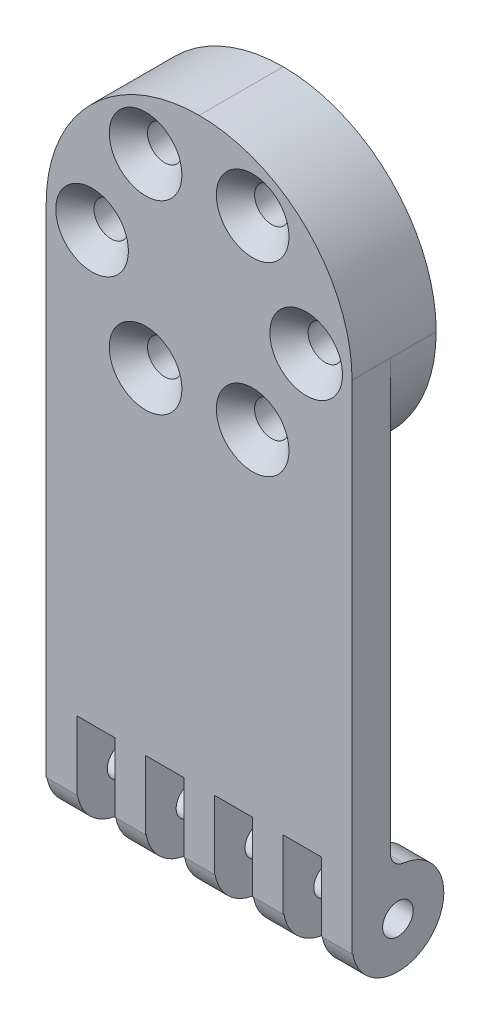
from build123d import *

# Parameters (mm, degrees)
SKETCH7_W           = 40
SKETCH7_H           = 40
BOSS_EXTRUDE1_DEPTH = 11
SKETCH8_W           = 40
SKETCH8_H           = 5
BOSS_EXTRUDE2_DEPTH = 36
SKETCH10_R          = 2.25
CUT_EXTRUDE1_DEPTH  = 25
FILLET1_R           = 20
SKETCH11_W          = 4
SKETCH11_H          = 5
BOSS_EXTRUDE3_DEPTH = 9
SKETCH14_R          = 6
BOSS_EXTRUDE4_DEPTH = 4
LPATTERN1_COUNT     = 5
LPATTERN1_PITCH     = 9
SKETCH15_R          = 2
CUT_EXTRUDE2_DEPTH  = 82.369527466
CHAMFER1_SIZE       = 2.5
FILLET2_R           = 2


with BuildPart() as part:
    # Sketch7 → Boss-Extrude1 (new body)
    with BuildSketch(Plane.XY):
        Rectangle(SKETCH7_W, SKETCH7_H)
    extrude(amount=BOSS_EXTRUDE1_DEPTH)

    # Sketch8 → Boss-Extrude2 (add)
    with BuildSketch(Plane.XZ.offset(20)):
        with Locations((0, 8.5)):
            Rectangle(SKETCH8_W, SKETCH8_H)
    extrude(amount=BOSS_EXTRUDE2_DEPTH)

    # Sketch10 → Cut-Extrude1 (cut)
    with BuildSketch(Plane.XY.offset(11)):
        with Locations((-7.00009521, 12.124420806)):
            Circle(SKETCH10_R)
        with Locations((6.99990479, 12.124420806)):
            Circle(SKETCH10_R)
        with Locations((13.99990479, 6.5153e-05)):
            Circle(SKETCH10_R)
        with Locations((6.99990479, -12.1242905)):
            Circle(SKETCH10_R)
        with Locations((-7.00009521, -12.1242905)):
            Circle(SKETCH10_R)
        with Locations((-14.00009521, 6.5153e-05)):
            Circle(SKETCH10_R)
    extrude(amount=-CUT_EXTRUDE1_DEPTH, mode=Mode.SUBTRACT)

    # Fillet1
    fillet1_edges = [part.edges().sort_by_distance(p)[0] for p in [
        (20, -20, 3),
        (20, 20, 5.5),
        (-20, 20, 5.5),
        (-20, -20, 3),
    ]]
    fillet(fillet1_edges, radius=FILLET1_R - 0.0001)  # a hair under: the kernel refuses the full size

    # Sketch11 → Boss-Extrude3 (add)
    with BuildSketch(Plane.XZ.offset(56)):
        with Locations((-18, 8.5)):
            Rectangle(SKETCH11_W, SKETCH11_H)
    boss_extrude3 = extrude(amount=BOSS_EXTRUDE3_DEPTH)

    # Sketch14 → Boss-Extrude4 (add)
    with BuildSketch(Plane(origin=(-16, 0, 0), x_dir=(0, 0, -1), z_dir=(1, 0, 0))):
        with Locations((-5, -64)):
            Circle(SKETCH14_R)
    boss_extrude4 = extrude(amount=-BOSS_EXTRUDE4_DEPTH)

    # LPattern1: Boss-Extrude3, Boss-Extrude4 ×5
    with Locations(*[(i * LPATTERN1_PITCH, 0, 0) for i in range(1, LPATTERN1_COUNT)]):
        add(boss_extrude3)
        add(boss_extrude4)

    # Sketch15 → Cut-Extrude2 (cut, through all)
    with BuildSketch(Plane.ZY.offset(20)):
        with Locations(Location((5, -64, 0), (0, 0, 270))):
            Circle(SKETCH15_R)
    extrude(amount=-CUT_EXTRUDE2_DEPTH, mode=Mode.SUBTRACT)

    # Chamfer1
    chamfer1_edges = [part.edges().sort_by_distance(p)[0] for p in [
        (-16.25009521, 6.5153e-05, 11),
        (-9.25009521, -12.1242905, 11),
        (4.74990479, -12.1242905, 11),
        (11.74990479, 6.5153e-05, 11),
        (4.74990479, 12.124420806, 11),
        (-9.25009521, 12.124420806, 11),
    ]]
    chamfer(chamfer1_edges, length=CHAMFER1_SIZE)

    # Fillet2
    fillet2_edges = [part.edges().sort_by_distance(p)[0] for p in [
        (-18, -58.083920217, 6),
        (-9, -58.083920217, 6),
        (0, -58.083920217, 6),
        (9, -58.083920217, 6),
        (18, -58.083920217, 6),
    ]]
    fillet(fillet2_edges, radius=FILLET2_R)


solid = part.part
